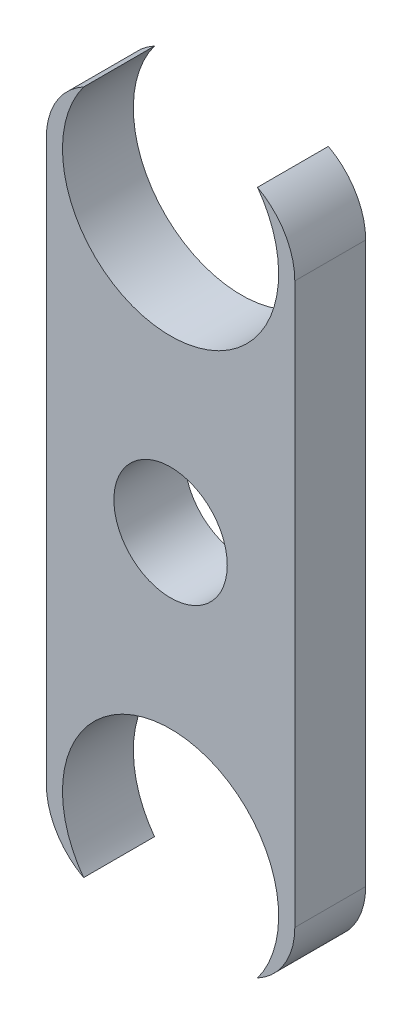
from build123d import *

# Parameters (mm, degrees)
SKETCH1_R           = 8
BOSS_EXTRUDE1_DEPTH = 10
FILLET1_R           = 10


with BuildPart() as part:
    # Sketch1 → Boss-Extrude1 (new body)
    with BuildSketch(Plane(origin=(0, 0, 0), x_dir=(0, 1, 0), z_dir=(0, 0, 1))):
        with BuildLine():
            Line((48.312247408, -17.530203429), (48.312247408, -12.265323963))
            ThreePointArc((48.312247408, -12.265323963), (24, 0), (48.312247408, 12.265323963))
            Line((48.312247408, 12.265323963), (48.312247408, 17.530203429))
            Line((48.312247408, 17.530203429), (-48.312247408, 17.530203429))
            Line((-48.312247408, 17.530203429), (-48.312247408, 12.265323963))
            ThreePointArc((-48.312247408, 12.265323963), (-24, 0), (-48.312247408, -12.265323963))
            Line((-48.312247408, -12.265323963), (-48.312247408, -17.530203429))
            Line((-48.312247408, -17.530203429), (48.312247408, -17.530203429))
        make_face()
        with Locations(Location((0, 0, 0), (0, 0, 270))):
            Circle(SKETCH1_R, mode=Mode.SUBTRACT)
    extrude(amount=BOSS_EXTRUDE1_DEPTH)

    # Fillet1
    # the kernel refuses this fillet: 10 mm, written as the material it takes off along each edge
    with BuildSketch(Plane(origin=(-17.530203429, 48.312247408, -22.019683457), x_dir=(1, 0, 0), z_dir=(0, 0, 1)), Plane(origin=(17.530203429, -48.312247408, -22.019683457), x_dir=(-1, 0, 0), z_dir=(0, 0, 1))) as fillet1_piece_1:
        with BuildLine():
            CenterArc((10, -8.807873383), FILLET1_R, 118.262514111, 61.737485889)
            Line((0, -8.807873383), (-0.2, -8.807873383))
            Line((-0.2, -8.807873383), (-0.2, 0))
            Line((-0.2, 0), (0, 0.2))
            ThreePointArc((0, 0.2), (2.632439733, 0.2), (5.170177055, 0.176157468))
            Line((5.170177055, 0.176157468), (5.264879466, 0))
        make_face()
    extrude(amount=54.039366915, mode=Mode.SUBTRACT)
    with BuildSketch(Plane(origin=(-17.530203429, -48.312247408, -22.019683457), x_dir=(0, 1, 0), z_dir=(0, 0, 1)), Plane(origin=(17.530203429, 48.312247408, -22.019683457), x_dir=(0, -1, 0), z_dir=(0, 0, 1))) as fillet1_piece_2:
        with BuildLine():
            CenterArc((8.807873383, -10), FILLET1_R, 90, 61.737485889)
            Line((0, -5.264879466), (-0.176157468, -5.170177055))
            ThreePointArc((-0.176157468, -5.170177055), (-0.2, -2.632439733), (-0.2, 0))
            Line((-0.2, 0), (0, 0.2))
            Line((0, 0.2), (8.807873383, 0.2))
            Line((8.807873383, 0.2), (8.807873383, 0))
        make_face()
    extrude(amount=54.039366915, mode=Mode.SUBTRACT)


solid = part.part
